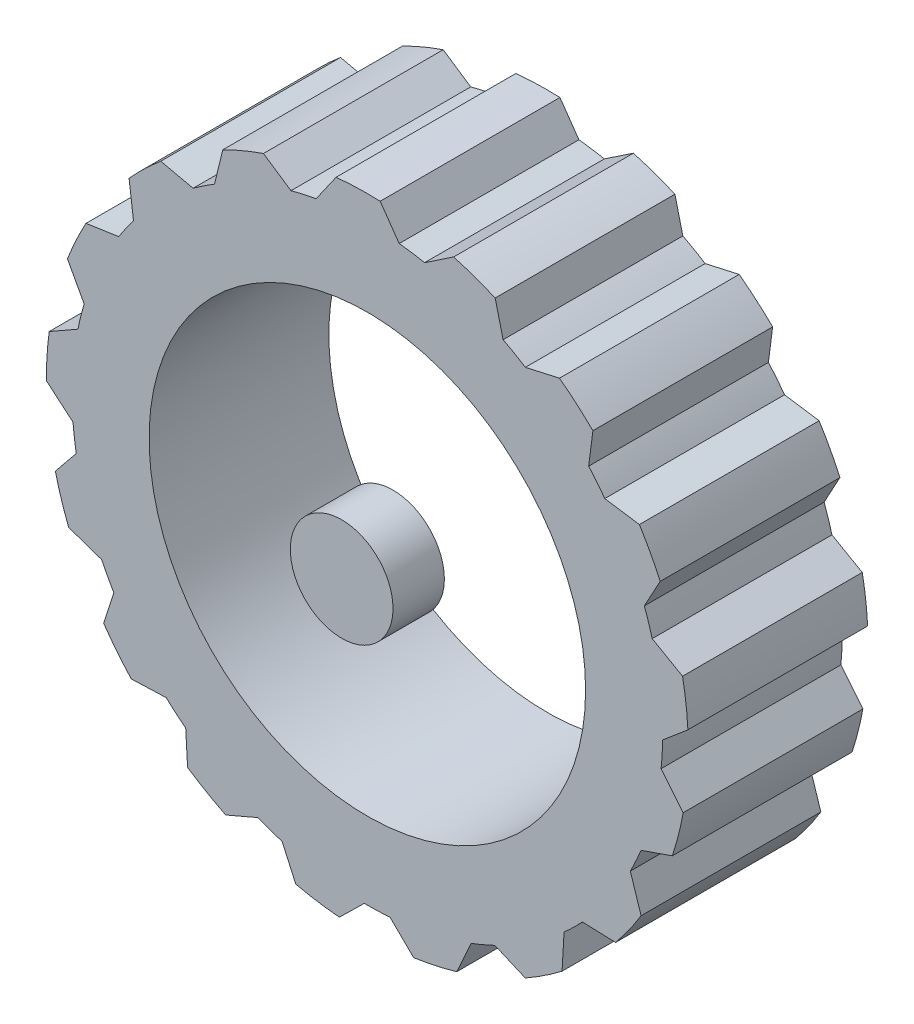
from build123d import *

# Parameters (mm, degrees)
SKETCH2_R           = 42.5
BOSS_EXTRUDE1_DEPTH = 35
SKETCH3_R           = 10
BOSS_EXTRUDE2_DEPTH = 5


with BuildPart() as part:
    # Sketch2 → Boss-Extrude1 (new body)
    with BuildSketch(Plane.XY):
        with BuildLine():
            Line((2.5, 62.449979984), (6.200811169, 57.164673889))
            ThreePointArc((6.200811169, 57.164673889), (8.680368121, 56.841016962), (11.143508297, 56.40985927))
            Line((11.143508297, 56.40985927), (16.799826716, 60.199799188))
            ThreePointArc((16.799826716, 60.199799188), (20.894606847, 58.903865787), (24.890715396, 57.329767896))
            Line((24.890715396, 57.329767896), (26.432346258, 51.064479546))
            ThreePointArc((26.432346258, 51.064479546), (28.627545889, 49.866959165), (30.768603577, 48.57512773))
            Line((30.768603577, 48.57512773), (37.412047635, 50.065843564))
            ThreePointArc((37.412047635, 50.065843564), (40.762171251, 47.378216459), (43.919801754, 44.466852979))
            Line((43.919801754, 44.466852979), (43.094046518, 38.067744282))
            ThreePointArc((43.094046518, 38.067744282), (44.708414954, 36.158092211), (46.238228449, 34.180056025))
            Line((46.238228449, 34.180056025), (52.971564213, 33.170218342))
            ThreePointArc((52.971564213, 33.170218342), (55.124578557, 29.453876467), (57.017275517, 25.598443168))
            Line((57.017275517, 25.598443168), (53.935657003, 19.929749212))
            ThreePointArc((53.935657003, 19.929749212), (54.751164841, 17.565874544), (55.463124355, 15.168778357))
            Line((55.463124355, 15.168778357), (61.376977518, 11.794771331))
            ThreePointArc((61.376977518, 11.794771331), (62.042106072, 7.551627248), (62.414250278, 3.272821761))
            Line((62.414250278, 3.272821761), (57.492958142, -0.899868923))
            ThreePointArc((57.492958142, -0.899868923), (57.399466531, -3.398711815), (57.197417984, -5.891126882))
            Line((57.197417984, -5.891126882), (61.493089908, -11.173624906))
            ThreePointArc((61.493089908, -11.173624906), (60.580503376, -15.370511076), (59.381834689, -19.49481236))
            Line((59.381834689, -19.49481236), (53.285516705, -21.607954774))
            ThreePointArc((53.285516705, -21.607954774), (52.295652203, -23.904283311), (51.206883373, -26.155402792))
            Line((51.206883373, -26.155402792), (53.304219761, -32.632961184))
            ThreePointArc((53.304219761, -32.632961184), (50.93716801, -36.216776708), (48.32957328, -39.629564048))
            Line((48.32957328, -39.629564048), (41.881570971, -39.397766599))
            ThreePointArc((41.881570971, -39.397766599), (40.129020266, -41.181448888), (38.300575416, -42.887246622))
            Line((38.300575416, -42.887246622), (37.916319367, -49.685035229))
            ThreePointArc((37.916319367, -49.685035229), (34.414485852, -52.171765962), (30.750135195, -54.412123516))
            Line((30.750135195, -54.412123516), (24.821287004, -51.866691734))
            ThreePointArc((24.821287004, -51.866691734), (22.542741779, -52.896831598), (20.221562517, -53.82693015))
            Line((20.221562517, -53.82693015), (17.40760994, -60.026869951))
            ThreePointArc((17.40760994, -60.026869951), (13.243936682, -61.080669128), (9.017720961, -61.846024195))
            Line((9.017720961, -61.846024195), (4.408750687, -57.330732748))
            ThreePointArc((4.408750687, -57.330732748), (1.911941101, -57.468204089), (-0.588484451, -57.496988495))
            Line((-0.588484451, -57.496988495), (-5.452093668, -62.261743267))
            ThreePointArc((-5.452093668, -62.261743267), (-9.715279524, -61.74028947), (-13.932586459, -60.927276606))
            Line((-13.932586459, -60.927276606), (-16.599211839, -55.051940623))
            ThreePointArc((-16.599211839, -55.051940623), (-18.977077817, -54.278177176), (-21.319053333, -53.401759943))
            Line((-21.319053333, -53.401759943), (-27.575461815, -56.08782315))
            ThreePointArc((-27.575461815, -56.08782315), (-31.362393395, -54.061541603), (-35.001220874, -51.779962701))
            Line((-35.001220874, -51.779962701), (-35.365358827, -45.338078863))
            ThreePointArc((-35.365358827, -45.338078863), (-37.30313722, -43.757581669), (-39.170365929, -42.094327801))
            Line((-39.170365929, -42.094327801), (-45.974611043, -42.338931723))
            ThreePointArc((-45.974611043, -42.338931723), (-48.773842254, -39.081482978), (-51.342746461, -35.639477911))
            Line((-51.342746461, -35.639477911), (-49.35521814, -29.501058327))
            ThreePointArc((-49.35521814, -29.501058327), (-50.591201238, -27.327282289), (-51.731503556, -25.101823436))
            Line((-51.731503556, -25.101823436), (-58.164634295, -22.871932959))
            ThreePointArc((-58.164634295, -22.871932959), (-59.598113451, -18.823253519), (-60.750149639, -14.685684144))
            Line((-60.750149639, -14.685684144), (-56.679381756, -9.679756392))
            ThreePointArc((-56.679381756, -9.679756392), (-57.046643193, -7.20628201), (-57.306014974, -4.719178723))
            Line((-57.306014974, -4.719178723), (-62.499201385, -0.315952911))
            ThreePointArc((-62.499201385, -0.315952911), (-62.373329183, 3.977160632), (-61.95290848, 8.251492642))
            Line((-61.95290848, 8.251492642), (-56.348680794, 11.448850281))
            ThreePointArc((-56.348680794, 11.448850281), (-55.797619879, 13.887966586), (-55.141031526, 16.300817227))
            Line((-55.141031526, 16.300817227), (-58.392905007, 22.282698328))
            ThreePointArc((-58.392905007, 22.282698328), (-56.724681185, 26.240437201), (-54.788583738, 30.074259625))
            Line((-54.788583738, 30.074259625), (-48.407778253, 31.031226283))
            ThreePointArc((-48.407778253, 31.031226283), (-47.012818814, 33.106568339), (-45.528946223, 35.119297485))
            Line((-45.528946223, 35.119297485), (-46.400323242, 41.871947686))
            ThreePointArc((-46.400323242, 41.871947686), (-43.415050671, 44.959797322), (-40.224757168, 47.835331198))
            Line((-40.224757168, 47.835331198), (-33.929137021, 46.422663226))
            ThreePointArc((-33.929137021, 46.422663226), (-31.878676062, 47.853944587), (-29.767924449, 49.194722014))
            Line((-29.767924449, 49.194722014), (-28.141120711, 55.806158488))
            ThreePointArc((-28.141120711, 55.806158488), (-24.241976993, 57.607087684), (-20.228354249, 59.135976227))
            Line((-20.228354249, 59.135976227), (-14.868177827, 55.544462263))
            ThreePointArc((-14.868177827, 55.544462263), (-12.439141462, 56.138380451), (-9.986579527, 56.626126738))
            Line((-9.986579527, 56.626126738), (-6.081303891, 62.203438353))
            ThreePointArc((-6.081303891, 62.203438353), (-1.794889992, 62.474221643), (2.5, 62.449979984))
        make_face()
        Circle(SKETCH2_R, mode=Mode.SUBTRACT)
    extrude(amount=-BOSS_EXTRUDE1_DEPTH)


with BuildPart() as body_2:
    # Sketch3 → Boss-Extrude2 (new, symmetric)
    with BuildSketch(Plane.XY):
        Circle(SKETCH3_R)
    extrude(amount=BOSS_EXTRUDE2_DEPTH, both=True)


solid = Compound([part.part, body_2.part])
